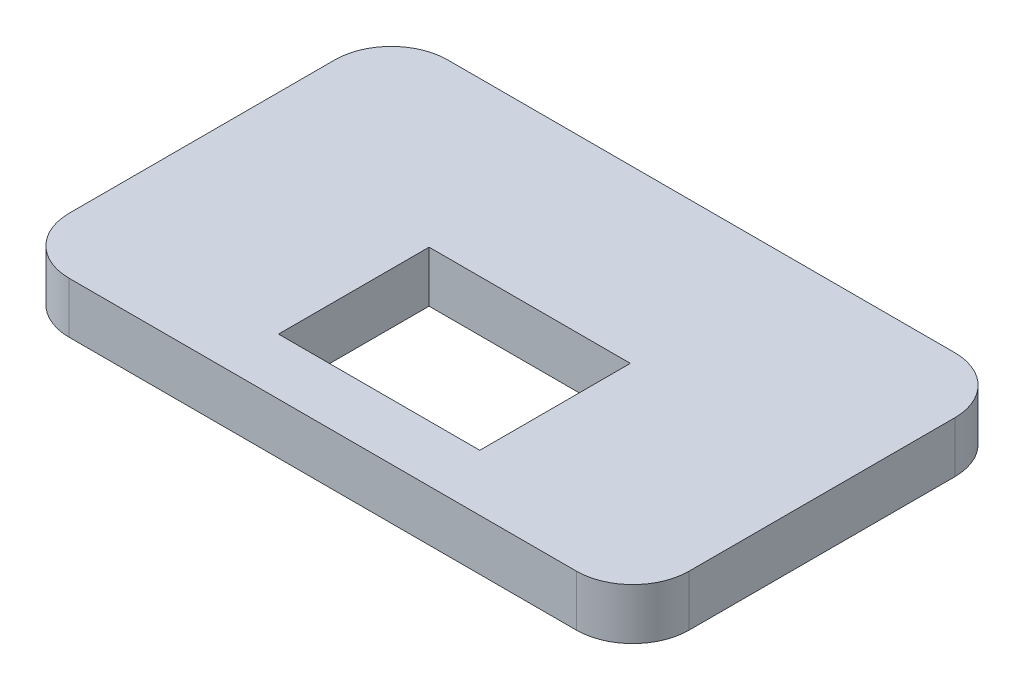
from build123d import *

# Parameters (mm, degrees)
BOSS_EXTRUDE1_DEPTH = 6.35
SKETCH2_W           = 25
SKETCH2_H           = 18.7
CUT_EXTRUDE1_DEPTH  = 91.434078201


with BuildPart() as part:
    # Sketch1 → Boss-Extrude1 (new body)
    with BuildSketch(Plane(origin=(0, 0, 0), x_dir=(1, 0, 0), z_dir=(0, 1, 0))):
        with BuildLine():
            Line((7, 0), (70, 0))
            ThreePointArc((70, 0), (74.949747468, 2.050252532), (77, 7))
            Line((77, 7), (77, 40))
            ThreePointArc((77, 40), (74.949747468, 44.949747468), (70, 47))
            Line((70, 47), (7, 47))
            ThreePointArc((7, 47), (2.050252532, 44.949747468), (0, 40))
            Line((0, 40), (0, 7))
            ThreePointArc((0, 7), (2.050252532, 2.050252532), (7, 0))
        make_face()
    extrude(amount=BOSS_EXTRUDE1_DEPTH)

    # Sketch2 → Cut-Extrude1 (cut, through all)
    with BuildSketch(Plane(origin=(0, 6.35, 0), x_dir=(1, 0, 0), z_dir=(0, 1, 0))):
        with Locations((38.5, 16.35)):
            Rectangle(SKETCH2_W, SKETCH2_H)
    extrude(amount=-CUT_EXTRUDE1_DEPTH, mode=Mode.SUBTRACT)


solid = part.part
